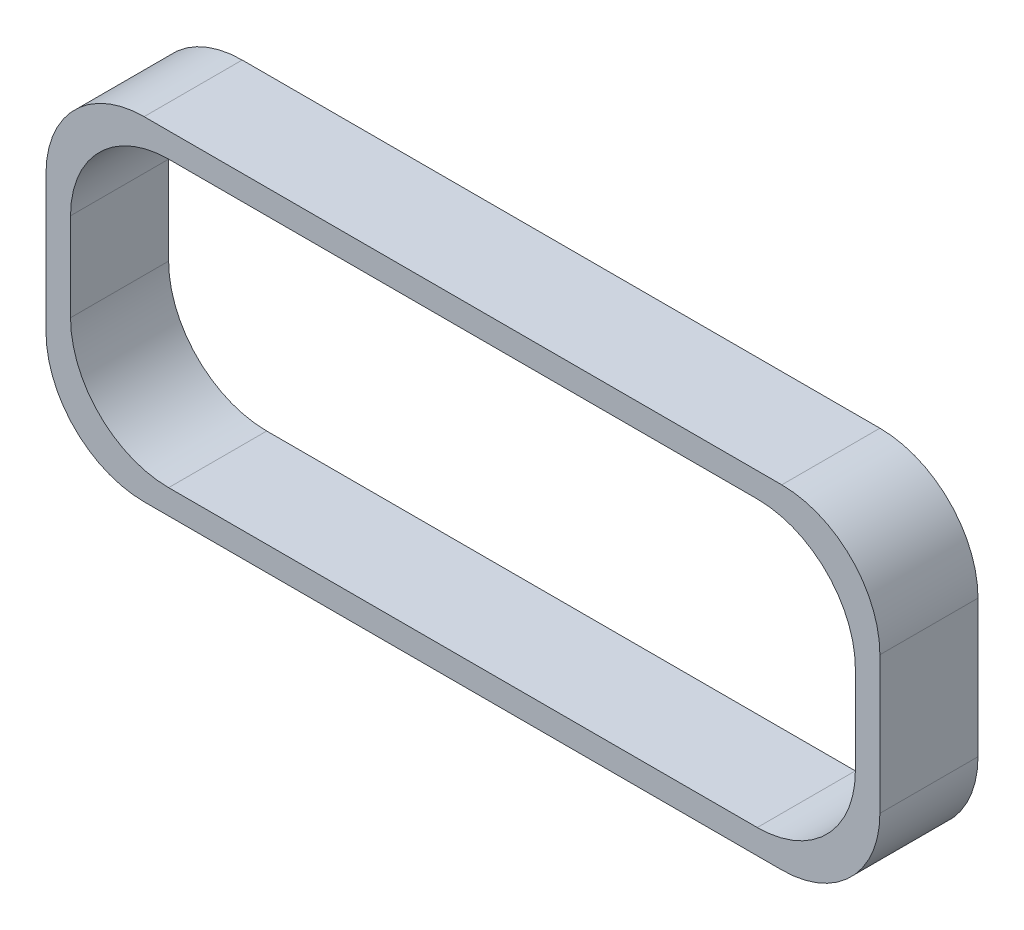
from build123d import *

# Parameters (mm, degrees)
ESQUISSE1_W        = 85
ESQUISSE1_H        = 34
ESQUISSE1_W_2      = 80
ESQUISSE1_H_2      = 29
BOSS_EXTRU_1_DEPTH = 10
CONG_1_R           = 10
CONG_2_R           = 10


with BuildPart() as part:
    # Esquisse1 → Boss.-Extru.1 (new body)
    with BuildSketch(Plane.XY):
        with Locations((40, 14.5)):
            Rectangle(ESQUISSE1_W, ESQUISSE1_H)
        with Locations((40, 14.5)):
            Rectangle(ESQUISSE1_W_2, ESQUISSE1_H_2, mode=Mode.SUBTRACT)
    extrude(amount=BOSS_EXTRU_1_DEPTH)

    # Congé1
    cong_1_edges = [part.edges().sort_by_distance(p)[0] for p in [
        (80, 0, 5),
        (80, 29, 5),
        (0, 0, 5),
        (0, 29, 5),
    ]]
    fillet(cong_1_edges, radius=CONG_1_R)

    # Congé2
    cong_2_edges = [part.edges().sort_by_distance(p)[0] for p in [
        (82.5, 31.5, 5),
        (82.5, -2.5, 5),
        (-2.5, -2.5, 5),
        (-2.5, 31.5, 5),
    ]]
    fillet(cong_2_edges, radius=CONG_2_R)


solid = part.part
